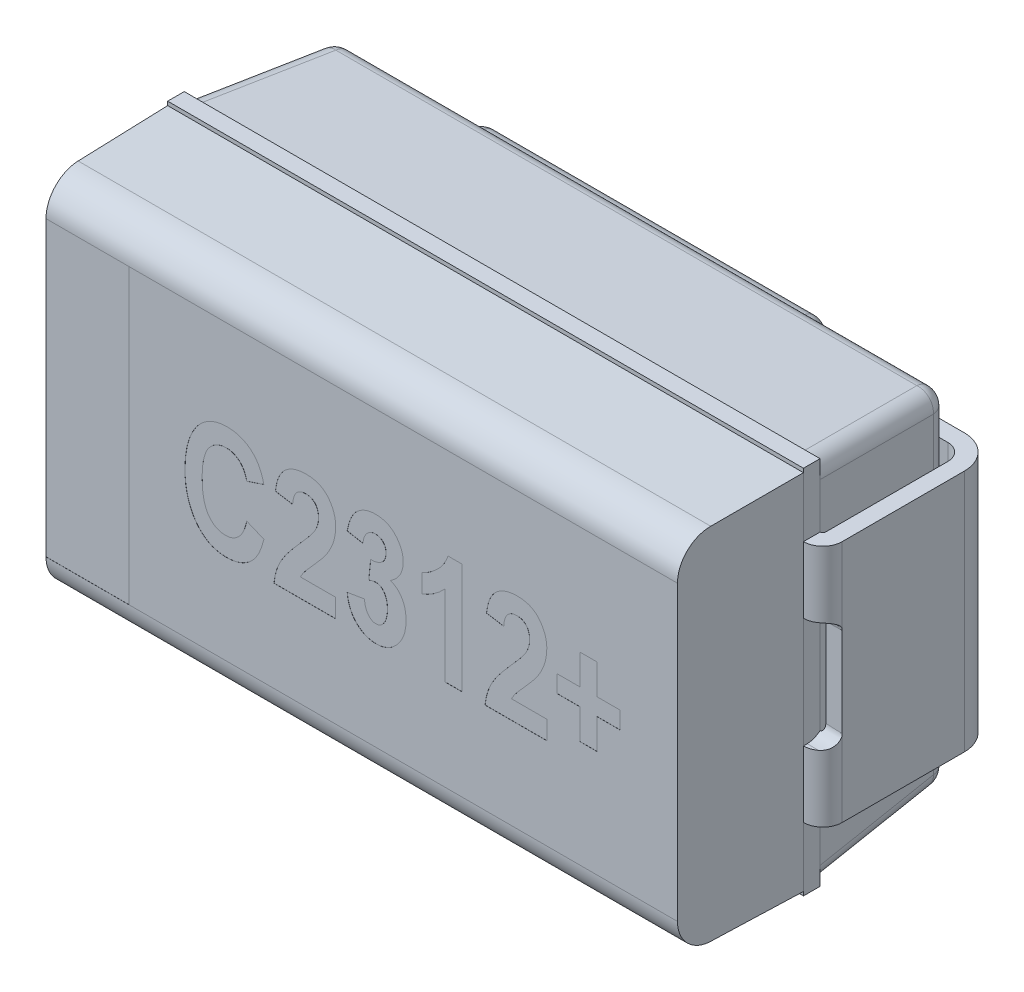
from build123d import *

# Parameters (mm, degrees)
BOSS_EXTRUDE1_START = 1.43
SKETCH1_W           = 5.75
SKETCH1_H           = 3.32
BOSS_EXTRUDE1_DEPTH = 1.26
BOSS_EXTRUDE1_DRAFT = -5
FILLET2_R           = 0.15
SKETCH3_W           = 5.75
SKETCH3_H           = 3.35
BOSS_EXTRUDE2_DEPTH = 0.15
SKETCH4_W           = 5.75
SKETCH4_H           = 3.28
BOSS_EXTRUDE4_DEPTH = 1.12
BOSS_EXTRUDE4_TAPER = 1
FILLET4_R           = 0.30115464
BOSS_EXTRUDE5_START = -0.01
SKETCH5_W           = 3.2
SKETCH5_H           = 2.9
BOSS_EXTRUDE5_DEPTH = 0.16
FILLET5_R           = 0.15
BOSS_EXTRUDE6_DEPTH = 1.1
CUT_EXTRUDE2_DEPTH  = 2.4
SKETCH10_W          = 0.75
SKETCH10_H          = 2.649012974
CUT_EXTRUDE3_DEPTH  = 0.001
CUT_EXTRUDE4_REACH  = 8.723


with BuildPart() as part:
    # Sketch1 → Boss-Extrude1 (with draft: the straight prism first)
    with BuildSketch(Plane.XY.offset(BOSS_EXTRUDE1_START)):
        Rectangle(SKETCH1_W, SKETCH1_H)
    extrude(amount=-BOSS_EXTRUDE1_DEPTH)
    # Boss-Extrude1: the draft: its side faces are tilted about the plane it starts from
    boss_extrude1_sides = [part.faces().sort_by_distance(p)[0] for p in [
        (-2.875, 0, 0.8),
        (0, -1.66, 0.8),
        (2.875, 0, 0.8),
        (0, 1.66, 0.8),
    ]]
    draft(boss_extrude1_sides, Plane.XY.offset(BOSS_EXTRUDE1_START), BOSS_EXTRUDE1_DRAFT)

    # Fillet2
    fillet2_edges = [part.edges().sort_by_distance(p)[0] for p in [
        (0, -1.549764284, 0.17),
        (-2.764764284, 0, 0.17),
        (0, 1.549764284, 0.17),
        (2.764764284, 0, 0.17),
        (-2.819882142, 1.604882142, 0.8),
        (-2.819882142, -1.604882142, 0.8),
        (2.819882142, -1.604882142, 0.8),
        (2.819882142, 1.604882142, 0.8),
    ]]
    fillet(fillet2_edges, radius=FILLET2_R)

    # Sketch3 → Boss-Extrude2 (add)
    with BuildSketch(Plane.XY.offset(1.43)):
        Rectangle(SKETCH3_W, SKETCH3_H)
    extrude(amount=BOSS_EXTRUDE2_DEPTH)

    # Sketch4 → Boss-Extrude4 (add)
    with BuildSketch(Plane.XY.offset(1.58)):
        Rectangle(SKETCH4_W, SKETCH4_H)
    extrude(amount=BOSS_EXTRUDE4_DEPTH, taper=BOSS_EXTRUDE4_TAPER)

    # Fillet4
    fillet4_edges = [part.edges().sort_by_distance(p)[0] for p in [
        (0, -1.620450327, 2.7),
        (0, 1.620450327, 2.7),
    ]]
    fillet(fillet4_edges, radius=FILLET4_R)

    # Sketch5 → Boss-Extrude5 (add)
    with BuildSketch(Plane(origin=(0, 0, 0.17), x_dir=(-1, 0, 0), z_dir=(0, 0, -1)).offset(BOSS_EXTRUDE5_START)):
        Rectangle(SKETCH5_W, SKETCH5_H)
    extrude(amount=BOSS_EXTRUDE5_DEPTH)

    # Fillet5
    fillet5_edges = [part.edges().sort_by_distance(p)[0] for p in [
        (0, -1.45, 0.02),
        (1.6, 0, 0.02),
        (0, 1.45, 0.02),
        (-1.6, 0, 0.02),
        (-1.6, 1.45, 0.097405559),
        (-1.6, -1.45, 0.097405559),
        (1.6, 1.45, 0.097405559),
        (1.6, -1.45, 0.097405559),
    ]]
    fillet(fillet5_edges, radius=FILLET5_R - 0.0001)  # a hair under: the kernel refuses the full size

    # Sketch7 → Boss-Extrude6 (add, symmetric)
    with BuildSketch(Plane(origin=(0, 0, 0), x_dir=(1, 0, 0), z_dir=(0, 1, 0))):
        with BuildLine():
            Line((2.875, -1.58), (2.875, -1.43))
            ThreePointArc((2.875, -1.43), (2.89267767, -1.42267767), (2.9, -1.405))
            Line((2.9, -1.405), (2.9, -0.3))
            ThreePointArc((2.9, -0.3), (2.856066017, -0.193933983), (2.75, -0.15))
            Line((2.75, -0.15), (1.779, -0.15))
            Line((1.779, -0.15), (1.779, 0))
            Line((1.779, 0), (2.75, 0))
            ThreePointArc((2.75, 0), (2.962132034, -0.087867966), (3.05, -0.3))
            Line((3.05, -0.3), (3.05, -1.405))
            ThreePointArc((3.05, -1.405), (2.998743687, -1.528743687), (2.875, -1.58))
        make_face()
        with BuildLine():
            Line((-3.05, -0.3), (-3.05, -1.405))
            ThreePointArc((-3.05, -1.405), (-2.998743687, -1.528743687), (-2.875, -1.58))
            Line((-2.875, -1.58), (-2.875, -1.43))
            ThreePointArc((-2.875, -1.43), (-2.89267767, -1.42267767), (-2.9, -1.405))
            Line((-2.9, -1.405), (-2.9, -0.3))
            ThreePointArc((-2.9, -0.3), (-2.856066017, -0.193933983), (-2.75, -0.15))
            Line((-2.75, -0.15), (-1.779, -0.15))
            Line((-1.779, -0.15), (-1.779, 0))
            Line((-1.779, 0), (-2.75, 0))
            ThreePointArc((-2.75, 0), (-2.962132034, -0.087867966), (-3.05, -0.3))
        make_face()
    extrude(amount=BOSS_EXTRUDE6_DEPTH, both=True)

    # Sketch9 → Cut-Extrude2 (cut)
    with BuildSketch(Plane.ZY.offset(2.875)):
        with BuildLine():
            Line((1.58, 0.686667464), (1.58, -0.686667464))
            add(Edge.make_bspline(
                [(1.58, -0.686667464), (1.573977213, -0.681133658), (1.549992927, -0.675599852), (1.477719503, -0.664532239), (1.429750935, -0.658998432), (1.381568653, -0.653464626)],
                knots=[4.39e-07, 4.39e-07, 4.39e-07, 4.39e-07, 0.5, 0.5, 1, 1, 1, 1], degree=3))
            Line((1.381568653, -0.653464626), (0.844643825, -0.547142878))
            ThreePointArc((0.844643825, -0.547142878), (0.757870339, -0.495208775), (0.723781045, -0.40000001))
            Line((0.723781045, -0.40000001), (0.723781045, 0.39999999))
            ThreePointArc((0.723781045, 0.39999999), (0.757870346, 0.49520876), (0.844643844, 0.547142858))
            Line((0.844643844, 0.547142858), (1.381568671, 0.653464606))
            add(Edge.make_bspline(
                [(1.58, 0.686667464), (1.579173952, 0.685908812), (1.576721603, 0.684291293), (1.570741873, 0.681814465), (1.562141058, 0.679237223), (1.551269301, 0.676659956), (1.538263498, 0.674082696), (1.523287156, 0.671505435), (1.506528622, 0.668928173), (1.488198657, 0.666350913), (1.468527704, 0.663773647), (1.447763395, 0.661196405), (1.426165889, 0.658619072), (1.404010381, 0.656042076), (1.389044845, 0.654323242), (1.381568671, 0.653464606)],
                knots=[0.004712512, 0.004712512, 0.004712512, 0.004712512, 0.008437871, 0.012656806, 0.016875741, 0.021094677, 0.025313612, 0.029532547, 0.033751483, 0.037970418, 0.042189353, 0.046408289, 0.050627224, 0.05484616, 0.059065095, 0.059065095, 0.059065095, 0.059065095], degree=3))
        make_face()
    extrude(amount=CUT_EXTRUDE2_DEPTH, mode=Mode.SUBTRACT)

    # Sketch10 → Cut-Extrude3 (cut)
    with BuildSketch(Plane.XY.offset(2.7)):
        with Locations((-2.480450327, 0)):
            Rectangle(SKETCH10_W, SKETCH10_H)
        with BuildLine():
            Line((-1.040584416, -0.136363636), (-0.88474026, -0.201298701))
            add(Edge.make_bspline(
                [(-0.88474026, -0.201298701), (-0.887958886, -0.214398838), (-0.894230538, -0.239925102), (-0.90609564, -0.276409308), (-0.919151828, -0.310261094), (-0.934088841, -0.34129098), (-0.950394565, -0.3697712), (-0.968506907, -0.395421501), (-0.988085099, -0.418373211), (-1.009240498, -0.438572703), (-1.031938795, -0.455952752), (-1.05554268, -0.47144014), (-1.080661674, -0.4841365), (-1.106944044, -0.494856622), (-1.134596417, -0.502825251), (-1.163408697, -0.508821974), (-1.193504553, -0.512253579), (-1.21400675, -0.512739784), (-1.224431818, -0.512987013)],
                knots=[0, 0, 0, 0, 1.282586353, 2.499182829, 3.646034602, 4.730797578, 5.771318175, 6.763713287, 7.712684321, 8.6363956, 9.539720391, 10.428356747, 11.317388874, 12.212151588, 13.124116906, 14.050177375, 15.008543639, 16, 16, 16, 16], degree=3))
            add(Edge.make_bspline(
                [(-1.224431818, -0.512987013), (-1.237512105, -0.512692936), (-1.263136078, -0.512116846), (-1.300526378, -0.505918262), (-1.336106469, -0.496500592), (-1.369812217, -0.48297676), (-1.401683589, -0.465690424), (-1.431383891, -0.444278756), (-1.459606155, -0.419538879), (-1.476015458, -0.400249065), (-1.484375, -0.390422078)],
                knots=[0, 0, 0, 0, 1.053414494, 2.063614103, 3.046293227, 4.01520277, 4.983805463, 5.961130836, 6.961320097, 8, 8, 8, 8], degree=3))
            add(Edge.make_bspline(
                [(-1.484375, -0.390422078), (-1.493563817, -0.378289428), (-1.512075537, -0.353847085), (-1.535315975, -0.313541703), (-1.555082413, -0.270240344), (-1.571260267, -0.223903762), (-1.583870052, -0.17448062), (-1.592685929, -0.121947356), (-1.597980132, -0.066329381), (-1.598672075, -0.028218004), (-1.599025974, -0.008725649)],
                knots=[0, 0, 0, 0, 0.898140554, 1.809387162, 2.740718204, 3.705966939, 4.703925369, 5.74945803, 6.848943185, 8, 8, 8, 8], degree=3))
            add(Edge.make_bspline(
                [(-1.599025974, -0.008725649), (-1.598702661, 0.011851286), (-1.598072903, 0.051931704), (-1.59240288, 0.110284982), (-1.583759172, 0.165298235), (-1.570871764, 0.216766987), (-1.554727445, 0.264986777), (-1.534781187, 0.309656912), (-1.511621579, 0.351244574), (-1.492725986, 0.376082128), (-1.48336039, 0.388392857)],
                knots=[0, 0, 0, 0, 1.171098873, 2.281104103, 3.334483992, 4.338438261, 5.297974877, 6.225356982, 7.120398547, 8, 8, 8, 8], degree=3))
            add(Edge.make_bspline(
                [(-1.48336039, 0.388392857), (-1.474856891, 0.39834414), (-1.458098318, 0.417955984), (-1.429453931, 0.443351945), (-1.398680865, 0.464939416), (-1.365790257, 0.482614071), (-1.330634933, 0.49636084), (-1.293386951, 0.506060775), (-1.253897178, 0.511784125), (-1.226885866, 0.512579922), (-1.213068182, 0.512987013)],
                knots=[0, 0, 0, 0, 1.017460211, 2.005195831, 2.96880208, 3.936538458, 4.903086366, 5.898753713, 6.925103759, 8, 8, 8, 8], degree=3))
            add(Edge.make_bspline(
                [(-1.213068182, 0.512987013), (-1.201760275, 0.512716343), (-1.179535116, 0.512184355), (-1.146945949, 0.507931398), (-1.115896755, 0.500453169), (-1.08608445, 0.490644065), (-1.057770589, 0.477519585), (-1.030873304, 0.461593795), (-1.005286819, 0.442919053), (-0.989778445, 0.428401184), (-0.981939935, 0.421063312)],
                knots=[0, 0, 0, 0, 1.062174293, 2.087653736, 3.080296642, 4.058948008, 5.03139012, 6.005719887, 6.992016441, 8, 8, 8, 8], degree=3))
            add(Edge.make_bspline(
                [(-0.981939935, 0.421063312), (-0.976489895, 0.415407881), (-0.965384246, 0.403883704), (-0.950430464, 0.384471947), (-0.936585857, 0.363093659), (-0.924098643, 0.339657607), (-0.912489677, 0.314392853), (-0.901933446, 0.28716989), (-0.892646904, 0.257926787), (-0.887416524, 0.237648602), (-0.88474026, 0.227272727)],
                knots=[0, 0, 0, 0, 0.858002413, 1.748367619, 2.673305357, 3.63929672, 4.648357542, 5.711115493, 6.828831091, 8, 8, 8, 8], degree=3))
            Line((-0.88474026, 0.227272727), (-1.040584416, 0.175324675))
            add(Edge.make_bspline(
                [(-1.040584416, 0.175324675), (-1.042048875, 0.181975902), (-1.044898469, 0.194918084), (-1.05061973, 0.213595413), (-1.057585136, 0.230942941), (-1.065163589, 0.247377118), (-1.074289308, 0.262329513), (-1.083835097, 0.276514559), (-1.095028429, 0.28908196), (-1.106853874, 0.300692084), (-1.11972855, 0.310725155), (-1.132906938, 0.319798502), (-1.146781936, 0.327342325), (-1.161295668, 0.333409456), (-1.176276232, 0.338319598), (-1.191835255, 0.341772531), (-1.207937131, 0.34386351), (-1.218878899, 0.34405743), (-1.224431818, 0.344155844)],
                knots=[0, 0, 0, 0, 1.200071046, 2.335138942, 3.437621639, 4.493482591, 5.51985659, 6.521917265, 7.50210956, 8.480124453, 9.438987346, 10.374745328, 11.297656865, 12.216555725, 13.143999084, 14.072438006, 15.021767148, 16, 16, 16, 16], degree=3))
            add(Edge.make_bspline(
                [(-1.224431818, 0.344155844), (-1.232290577, 0.343922841), (-1.24775742, 0.343464266), (-1.270417675, 0.339815754), (-1.291857356, 0.333362554), (-1.312399243, 0.324890773), (-1.331698156, 0.313603838), (-1.349968937, 0.299935201), (-1.366720304, 0.283471785), (-1.382774723, 0.264953268), (-1.397322743, 0.24349724), (-1.409675005, 0.218699776), (-1.419863379, 0.190649404), (-1.428639462, 0.159547299), (-1.435205586, 0.125189117), (-1.439762274, 0.087628064), (-1.442606161, 0.046918611), (-1.44298552, 0.018673715), (-1.443181818, 0.004058442)],
                knots=[0, 0, 0, 0, 0.827686898, 1.628972485, 2.409099021, 3.181967192, 3.964173723, 4.757978677, 5.579415306, 6.433460257, 7.33665582, 8.302235029, 9.343905073, 10.476376866, 11.703364719, 13.024698166, 14.460435141, 16, 16, 16, 16], degree=3))
            add(Edge.make_bspline(
                [(-1.443181818, 0.004058442), (-1.442960011, -0.011095871), (-1.442532877, -0.040278488), (-1.44004303, -0.08242797), (-1.435310422, -0.121153689), (-1.429252325, -0.156607918), (-1.420962386, -0.188583424), (-1.410834625, -0.217099791), (-1.399169055, -0.242435415), (-1.385253281, -0.264257887), (-1.369834328, -0.283097178), (-1.353441161, -0.299453787), (-1.335757292, -0.313117458), (-1.317255811, -0.32469734), (-1.297428776, -0.333472268), (-1.276510752, -0.339442532), (-1.254625793, -0.343571874), (-1.239603138, -0.343958581), (-1.231939935, -0.344155844)],
                knots=[0, 0, 0, 0, 1.588381619, 3.058741945, 4.422565575, 5.675514383, 6.825848758, 7.879737597, 8.8437938, 9.742560847, 10.584031071, 11.391113559, 12.163968987, 12.921455088, 13.673648094, 14.427376256, 15.197789283, 16, 16, 16, 16], degree=3))
            add(Edge.make_bspline(
                [(-1.231939935, -0.344155844), (-1.226319622, -0.34398178), (-1.215170497, -0.343636485), (-1.198764462, -0.341437746), (-1.182932913, -0.337506443), (-1.167673715, -0.332052206), (-1.153051903, -0.324856036), (-1.138917457, -0.316330665), (-1.12555591, -0.306083076), (-1.112620561, -0.294447443), (-1.100420193, -0.281064408), (-1.089269989, -0.265677688), (-1.07891019, -0.248562282), (-1.069403425, -0.229612043), (-1.060689062, -0.208948767), (-1.053005556, -0.18641389), (-1.046052696, -0.162119916), (-1.042442285, -0.14511443), (-1.040584416, -0.136363636)],
                knots=[0, 0, 0, 0, 0.874040642, 1.73385169, 2.568061146, 3.406503852, 4.248567505, 5.09821747, 5.96915136, 6.862782357, 7.800986125, 8.779254107, 9.812897901, 10.908933612, 12.073249979, 13.297367906, 14.609261928, 16, 16, 16, 16], degree=3))
        make_face()
        with BuildLine():
            Line((-0.23538961, -0.331168831), (-0.23538961, -0.5))
            Line((-0.23538961, -0.5), (-0.793831169, -0.5))
            add(Edge.make_bspline(
                [(-0.793831169, -0.5), (-0.791866317, -0.483371878), (-0.787941953, -0.450160812), (-0.77605879, -0.401416985), (-0.760040465, -0.353798597), (-0.742500339, -0.315024186), (-0.725093959, -0.283716795), (-0.709522773, -0.258172511), (-0.690979177, -0.230990775), (-0.669485332, -0.202208417), (-0.645652547, -0.171398924), (-0.61895372, -0.138885435), (-0.589527899, -0.104639318), (-0.56876342, -0.081403726), (-0.558035714, -0.069399351)],
                knots=[0, 0, 0, 0, 1.20268352, 2.402099407, 3.598367202, 4.810420478, 5.454599206, 6.172593709, 6.960183653, 7.818888272, 8.754527026, 9.759992126, 10.842728215, 12, 12, 12, 12], degree=3))
            add(Edge.make_bspline(
                [(-0.558035714, -0.069399351), (-0.549624495, -0.060018232), (-0.533533083, -0.042071313), (-0.510899113, -0.016082491), (-0.490539925, 0.00728779), (-0.47310434, 0.028521986), (-0.457977984, 0.047176105), (-0.445441949, 0.06353451), (-0.435345891, 0.077455394), (-0.429949548, 0.086213896), (-0.427556818, 0.090097403)],
                knots=[0, 0, 0, 0, 1.465870871, 2.804341841, 4.009590698, 5.071600616, 6.000740577, 6.80347298, 7.469461756, 8, 8, 8, 8], degree=3))
            add(Edge.make_bspline(
                [(-0.427556818, 0.090097403), (-0.422003652, 0.100045175), (-0.41116375, 0.119463446), (-0.399875704, 0.150235139), (-0.392497376, 0.181062308), (-0.391651858, 0.201799466), (-0.391233766, 0.212053571)],
                knots=[0, 0, 0, 0, 1.060288104, 2.069705834, 3.04550853, 4, 4, 4, 4], degree=3))
            add(Edge.make_bspline(
                [(-0.391233766, 0.212053571), (-0.391592878, 0.22229899), (-0.3922727, 0.241694223), (-0.398090791, 0.268792662), (-0.407817222, 0.292096946), (-0.421875814, 0.311018077), (-0.438990886, 0.325870439), (-0.458731873, 0.336708568), (-0.481073847, 0.34312894), (-0.496778617, 0.343806663), (-0.50487013, 0.344155844)],
                knots=[0, 0, 0, 0, 1.245810787, 2.358399634, 3.353971925, 4.295778042, 5.200327805, 6.09189762, 7.016895116, 8, 8, 8, 8], degree=3))
            add(Edge.make_bspline(
                [(-0.50487013, 0.344155844), (-0.513644523, 0.343772419), (-0.530462184, 0.343037518), (-0.554115574, 0.336195521), (-0.5746455, 0.324916913), (-0.591469153, 0.308547663), (-0.605276753, 0.288097037), (-0.61524556, 0.262958615), (-0.622080386, 0.233609955), (-0.623987995, 0.212498526), (-0.625, 0.201298701)],
                knots=[0, 0, 0, 0, 0.999920937, 1.916523715, 2.784458762, 3.647604167, 4.570853193, 5.582015381, 6.717234977, 8, 8, 8, 8], degree=3))
            Line((-0.625, 0.201298701), (-0.780844156, 0.227272727))
            add(Edge.make_bspline(
                [(-0.780844156, 0.227272727), (-0.779539175, 0.238664931), (-0.777007666, 0.260764459), (-0.770304359, 0.292507359), (-0.762365711, 0.322012621), (-0.752425553, 0.349127549), (-0.740637748, 0.37388751), (-0.726962358, 0.396265212), (-0.711793679, 0.416637199), (-0.694366186, 0.43431516), (-0.675375297, 0.449781056), (-0.654949188, 0.463317835), (-0.632937475, 0.474637136), (-0.609532151, 0.484076171), (-0.584521383, 0.491064393), (-0.558159607, 0.496414197), (-0.530238043, 0.499431636), (-0.511167658, 0.499807758), (-0.501420455, 0.5)],
                knots=[0, 0, 0, 0, 1.257113927, 2.438652199, 3.554660598, 4.606291011, 5.601856267, 6.557471959, 7.478981492, 8.381416587, 9.2725261, 10.161501808, 11.064119884, 11.98308707, 12.924775989, 13.908409216, 14.930951759, 16, 16, 16, 16], degree=3))
            add(Edge.make_bspline(
                [(-0.501420455, 0.5), (-0.490716075, 0.499827613), (-0.469968042, 0.499493478), (-0.439912108, 0.49515741), (-0.411771104, 0.488979426), (-0.385821922, 0.479369747), (-0.361610884, 0.46781024), (-0.339839404, 0.452845667), (-0.319614456, 0.435885108), (-0.302274267, 0.415749728), (-0.286489574, 0.394466538), (-0.272936617, 0.372035252), (-0.261201946, 0.34905133), (-0.251851055, 0.325103755), (-0.244571208, 0.300378511), (-0.23932489, 0.274928261), (-0.235888474, 0.248741095), (-0.235557623, 0.231003975), (-0.23538961, 0.221996753)],
                knots=[0, 0, 0, 0, 1.185802577, 2.298411505, 3.360827086, 4.373838454, 5.359924385, 6.327149754, 7.295159843, 8.277960573, 9.264958702, 10.230903902, 11.180079425, 12.122922977, 13.076886226, 14.034409875, 15.001838751, 16, 16, 16, 16], degree=3))
            add(Edge.make_bspline(
                [(-0.23538961, 0.221996753), (-0.235560125, 0.211773185), (-0.235898648, 0.1914763), (-0.239375287, 0.161251699), (-0.244510137, 0.131448295), (-0.252127197, 0.102026006), (-0.261976869, 0.072835162), (-0.27397083, 0.043623042), (-0.288182578, 0.014293769), (-0.302177178, -0.010007275), (-0.314716601, -0.030196203), (-0.325882572, -0.04633337), (-0.338607865, -0.063414235), (-0.352535708, -0.081726202), (-0.368212216, -0.100916784), (-0.385255102, -0.121214355), (-0.403723955, -0.142523538), (-0.416645585, -0.156945101), (-0.423295455, -0.164366883)],
                knots=[0, 0, 0, 0, 1.112568374, 2.208785751, 3.308090549, 4.402946702, 5.513734595, 6.659701235, 7.83876403, 9.059051271, 9.71083511, 10.425746939, 11.194567613, 12.029688168, 12.930202216, 13.891926091, 14.915120021, 16, 16, 16, 16], degree=3))
            add(Edge.make_bspline(
                [(-0.423295455, -0.164366883), (-0.429453041, -0.171196406), (-0.441192582, -0.184217004), (-0.457937155, -0.202862367), (-0.472596156, -0.219967087), (-0.485882076, -0.234908665), (-0.497214321, -0.24812573), (-0.506881791, -0.259454044), (-0.514454172, -0.269227136), (-0.52592364, -0.283505668), (-0.539698011, -0.303604164), (-0.549475235, -0.322213644), (-0.554180195, -0.331168831)],
                knots=[0, 0, 0, 0, 1.297038255, 2.472825099, 3.534584971, 4.474279189, 5.292832013, 5.990344774, 6.574432518, 7.036342243, 8.573839243, 10, 10, 10, 10], degree=3))
            Line((-0.554180195, -0.331168831), (-0.23538961, -0.331168831))
        make_face()
        with BuildLine():
            Line((-0.131493506, -0.24025974), (0.024350649, -0.214285714))
            add(Edge.make_bspline(
                [(0.024350649, -0.214285714), (0.025495391, -0.225219963), (0.027666139, -0.245954344), (0.034983579, -0.274766907), (0.045065367, -0.29966597), (0.05820316, -0.320337542), (0.073741895, -0.336515758), (0.090624996, -0.348553548), (0.109211398, -0.355922247), (0.122164023, -0.356735474), (0.128652597, -0.357142857)],
                knots=[0, 0, 0, 0, 1.355304156, 2.570034305, 3.655187229, 4.657770736, 5.572822417, 6.406427783, 7.201705401, 8, 8, 8, 8], degree=3))
            add(Edge.make_bspline(
                [(0.128652597, -0.357142857), (0.135706341, -0.35659551), (0.14978144, -0.355503328), (0.169712312, -0.346537227), (0.187575805, -0.332122407), (0.203295108, -0.312367333), (0.216426, -0.287810082), (0.225607283, -0.25857815), (0.231292989, -0.225329659), (0.231850068, -0.20172985), (0.232142857, -0.189326299)],
                knots=[0, 0, 0, 0, 0.773544105, 1.543536286, 2.359413735, 3.279902328, 4.302047568, 5.405756159, 6.636521274, 8, 8, 8, 8], degree=3))
            add(Edge.make_bspline(
                [(0.232142857, -0.189326299), (0.231856708, -0.177731875), (0.231313924, -0.15573896), (0.2255565, -0.124711405), (0.216358908, -0.097472458), (0.203409949, -0.074453004), (0.187776385, -0.05592036), (0.17016258, -0.042290033), (0.150498797, -0.0339799), (0.136777311, -0.032973925), (0.12987013, -0.032467532)],
                knots=[0, 0, 0, 0, 1.339089583, 2.540055761, 3.633194076, 4.648755064, 5.575000742, 6.418014354, 7.203653244, 8, 8, 8, 8], degree=3))
            add(Edge.make_bspline(
                [(0.12987013, -0.032467532), (0.124985612, -0.032604281), (0.11473325, -0.032891311), (0.098769697, -0.036152524), (0.081352026, -0.040440415), (0.069501819, -0.044667119), (0.063311688, -0.046875)],
                knots=[0, 0, 0, 0, 0.855386015, 1.795412945, 2.848401334, 4, 4, 4, 4], degree=3))
            Line((0.063311688, -0.046875), (0.080357143, 0.123376623))
            add(Edge.make_bspline(
                [(0.080357143, 0.123376623), (0.090534678, 0.123521483), (0.109976789, 0.123798208), (0.137469299, 0.129375617), (0.162051861, 0.138663847), (0.175578733, 0.148687656), (0.182224026, 0.153612013)],
                knots=[0, 0, 0, 0, 1.123342484, 2.145917298, 3.089152036, 4, 4, 4, 4], degree=3))
            add(Edge.make_bspline(
                [(0.182224026, 0.153612013), (0.187963157, 0.159099271), (0.199447313, 0.170079423), (0.210928994, 0.191579846), (0.21811519, 0.215918442), (0.218798596, 0.233236177), (0.219155844, 0.242288961)],
                knots=[0, 0, 0, 0, 0.955076279, 1.911133417, 2.908052488, 4, 4, 4, 4], degree=3))
            add(Edge.make_bspline(
                [(0.219155844, 0.242288961), (0.218886937, 0.24982715), (0.218371304, 0.264281704), (0.213289783, 0.284679232), (0.204595961, 0.302497783), (0.19244077, 0.317368689), (0.177824308, 0.329422325), (0.160966711, 0.338145052), (0.142148969, 0.343347722), (0.128956726, 0.343881039), (0.122159091, 0.344155844)],
                knots=[0, 0, 0, 0, 1.139827297, 2.185630357, 3.156691862, 4.118036265, 5.071436669, 6.005944982, 6.972512938, 8, 8, 8, 8], degree=3))
            add(Edge.make_bspline(
                [(0.122159091, 0.344155844), (0.115279695, 0.343782364), (0.101712228, 0.34304579), (0.082089853, 0.336604107), (0.064021572, 0.3260606), (0.047697443, 0.311432885), (0.033450576, 0.292932751), (0.02259124, 0.270188746), (0.014811201, 0.243598285), (0.01255538, 0.224418398), (0.011363636, 0.214285714)],
                knots=[0, 0, 0, 0, 0.873177957, 1.72207174, 2.597112569, 3.517339763, 4.493004119, 5.547245842, 6.704216451, 8, 8, 8, 8], degree=3))
            Line((0.011363636, 0.214285714), (-0.131493506, 0.24025974))
            add(Edge.make_bspline(
                [(-0.131493506, 0.24025974), (-0.129441418, 0.251240719), (-0.125454333, 0.272576112), (-0.11779878, 0.303245001), (-0.108655695, 0.331586332), (-0.098205359, 0.357632386), (-0.086135275, 0.381256453), (-0.073045607, 0.402729898), (-0.058311953, 0.421749245), (-0.04225434, 0.438493513), (-0.024815018, 0.452897836), (-0.006527709, 0.465671952), (0.013092208, 0.476151285), (0.033622925, 0.484988407), (0.055345342, 0.49165201), (0.078078813, 0.496542579), (0.101997603, 0.499393954), (0.118296022, 0.499795062), (0.126623377, 0.5)],
                knots=[0, 0, 0, 0, 1.323888492, 2.572237035, 3.743577151, 4.851233338, 5.894614541, 6.884670373, 7.827607971, 8.740482364, 9.628407284, 10.504600047, 11.379912067, 12.259984237, 13.150042074, 14.068357082, 15.013065329, 16, 16, 16, 16], degree=3))
            add(Edge.make_bspline(
                [(0.126623377, 0.5), (0.135901887, 0.499774505), (0.154060307, 0.499333203), (0.180521377, 0.495643012), (0.205439391, 0.489490261), (0.229017641, 0.481249528), (0.251048695, 0.470176517), (0.271585866, 0.456663556), (0.290928869, 0.441036631), (0.308062445, 0.422676049), (0.323742015, 0.403278327), (0.337442309, 0.383040895), (0.34906573, 0.362371328), (0.358458733, 0.34108657), (0.365820036, 0.3192863), (0.371038648, 0.29693028), (0.374478606, 0.27411895), (0.374825707, 0.258737998), (0.375, 0.25101461)],
                knots=[0, 0, 0, 0, 1.136110954, 2.223415207, 3.264275915, 4.275773003, 5.276148026, 6.275733691, 7.282435396, 8.313756446, 9.34497766, 10.335353855, 11.303404599, 12.245547817, 13.180854416, 14.117297809, 15.054620354, 16, 16, 16, 16], degree=3))
            add(Edge.make_bspline(
                [(0.375, 0.25101461), (0.374666754, 0.240639653), (0.374012813, 0.220280469), (0.368324228, 0.190539665), (0.359222455, 0.162328526), (0.346277885, 0.135723461), (0.329754647, 0.110754228), (0.30921386, 0.087729266), (0.285568054, 0.065782486), (0.267421033, 0.0532834), (0.258116883, 0.046875)],
                knots=[0, 0, 0, 0, 1.011301464, 1.98451623, 2.942285919, 3.895498898, 4.861777034, 5.853076579, 6.899251942, 8, 8, 8, 8], degree=3))
            add(Edge.make_bspline(
                [(0.258116883, 0.046875), (0.263303633, 0.045235869), (0.273690381, 0.04195342), (0.288398329, 0.034892458), (0.302544555, 0.026823794), (0.315792431, 0.017137347), (0.328417676, 0.006202413), (0.340144672, -0.006242675), (0.351244523, -0.019987029), (0.361439433, -0.035083361), (0.370867118, -0.051359751), (0.37895044, -0.068745748), (0.385574911, -0.087204257), (0.39140201, -0.106457451), (0.395479874, -0.12686889), (0.398843627, -0.148106409), (0.400629802, -0.170423829), (0.400857369, -0.185603301), (0.400974026, -0.19338474)],
                knots=[0, 0, 0, 0, 0.869078506, 1.740376712, 2.603304645, 3.471170013, 4.360750356, 5.271463819, 6.202516728, 7.183826632, 8.182284299, 9.208495033, 10.245655502, 11.31723451, 12.422795936, 13.571969507, 14.755320907, 16, 16, 16, 16], degree=3))
            add(Edge.make_bspline(
                [(0.400974026, -0.19338474), (0.40077702, -0.204694177), (0.400391231, -0.226840894), (0.396282791, -0.259245207), (0.390375735, -0.290255134), (0.381617171, -0.319828899), (0.370184353, -0.347819437), (0.35656353, -0.374474162), (0.340280073, -0.399478935), (0.321610556, -0.422612448), (0.301627042, -0.443860256), (0.280095816, -0.462212388), (0.2578485, -0.477971114), (0.234384095, -0.490686611), (0.210089277, -0.500620406), (0.184790467, -0.507829174), (0.158565961, -0.51218227), (0.140709014, -0.512717086), (0.131696429, -0.512987013)],
                knots=[0, 0, 0, 0, 1.166897813, 2.285079005, 3.366956394, 4.423061867, 5.463022754, 6.484271357, 7.508856759, 8.537242389, 9.549763851, 10.515452122, 11.453061742, 12.359226731, 13.264341812, 14.157335176, 15.069987983, 16, 16, 16, 16], degree=3))
            add(Edge.make_bspline(
                [(0.131696429, -0.512987013), (0.123094682, -0.512742499), (0.106092287, -0.512259187), (0.081147975, -0.508748331), (0.05722287, -0.50306145), (0.034282163, -0.495102189), (0.012374149, -0.484763584), (-0.008477376, -0.471984821), (-0.028404879, -0.457215267), (-0.047053314, -0.440107286), (-0.064310032, -0.42107007), (-0.079754589, -0.400138699), (-0.09317179, -0.377450124), (-0.104746886, -0.353198114), (-0.114553904, -0.327362174), (-0.122143874, -0.299823544), (-0.128201641, -0.270691125), (-0.130378575, -0.250566633), (-0.131493506, -0.24025974)],
                knots=[0, 0, 0, 0, 0.984295986, 1.945580355, 2.876939409, 3.795076914, 4.719719193, 5.643810347, 6.589854471, 7.554313356, 8.535437924, 9.526409237, 10.526171694, 11.547669046, 12.598749286, 13.68449719, 14.814099809, 16, 16, 16, 16], degree=3))
        make_face()
        with BuildLine():
            Line((0.907467532, -0.5), (0.751623377, -0.5))
            Line((0.751623377, -0.5), (0.751623377, 0.227272727))
            add(Edge.make_bspline(
                [(0.751623377, 0.227272727), (0.744064968, 0.219341364), (0.729074875, 0.203611614), (0.70522674, 0.181652296), (0.680553813, 0.161406945), (0.654893287, 0.142783775), (0.628538778, 0.125606026), (0.601156886, 0.110100844), (0.572979793, 0.096235854), (0.553554393, 0.088358519), (0.543831169, 0.084415584)],
                knots=[0, 0, 0, 0, 1.033480345, 2.049633457, 3.05634389, 4.043072978, 5.039658923, 6.022790494, 7.010324124, 8, 8, 8, 8], degree=3))
            Line((0.543831169, 0.084415584), (0.543831169, 0.253246753))
            add(Edge.make_bspline(
                [(0.543831169, 0.253246753), (0.555038642, 0.258227852), (0.578371967, 0.268598217), (0.612507412, 0.289419754), (0.646982835, 0.31549434), (0.675588938, 0.340523891), (0.697900647, 0.362792725), (0.713798532, 0.380332179), (0.728031239, 0.398857957), (0.741221329, 0.417708773), (0.752867315, 0.437423706), (0.763149093, 0.45762428), (0.77227259, 0.478442268), (0.777031571, 0.492788687), (0.779423701, 0.5)],
                knots=[0, 0, 0, 0, 1.256071058, 2.615068939, 4.086222451, 5.682781329, 6.506361962, 7.316438188, 8.106904776, 8.89922375, 9.673254088, 10.451495518, 11.221635059, 12, 12, 12, 12], degree=3))
            Line((0.779423701, 0.5), (0.907467532, 0.5))
            Line((0.907467532, 0.5), (0.907467532, -0.5))
        make_face()
        with BuildLine():
            Line((1.673701299, -0.331168831), (1.673701299, -0.5))
            Line((1.673701299, -0.5), (1.11525974, -0.5))
            add(Edge.make_bspline(
                [(1.11525974, -0.5), (1.117224592, -0.483371878), (1.121148956, -0.450160812), (1.133032119, -0.401416985), (1.149050444, -0.353798597), (1.16659057, -0.315024186), (1.18399695, -0.283716795), (1.199568136, -0.258172511), (1.218111732, -0.230990775), (1.239605577, -0.202208417), (1.263438362, -0.171398924), (1.290137189, -0.138885435), (1.31956301, -0.104639318), (1.340327489, -0.081403726), (1.351055195, -0.069399351)],
                knots=[0, 0, 0, 0, 1.20268352, 2.402099407, 3.598367202, 4.810420478, 5.454599206, 6.172593709, 6.960183653, 7.818888272, 8.754527026, 9.759992126, 10.842728215, 12, 12, 12, 12], degree=3))
            add(Edge.make_bspline(
                [(1.351055195, -0.069399351), (1.359466414, -0.060018232), (1.375557827, -0.042071313), (1.398191796, -0.016082491), (1.418550984, 0.00728779), (1.435986569, 0.028521986), (1.451112926, 0.047176105), (1.46364896, 0.06353451), (1.473745018, 0.077455394), (1.479141361, 0.086213896), (1.481534091, 0.090097403)],
                knots=[0, 0, 0, 0, 1.465870871, 2.804341841, 4.009590698, 5.071600616, 6.000740577, 6.80347298, 7.469461756, 8, 8, 8, 8], degree=3))
            add(Edge.make_bspline(
                [(1.481534091, 0.090097403), (1.487087257, 0.100045175), (1.497927159, 0.119463446), (1.509215205, 0.150235139), (1.516593533, 0.181062308), (1.517439051, 0.201799466), (1.517857143, 0.212053571)],
                knots=[0, 0, 0, 0, 1.060288104, 2.069705834, 3.04550853, 4, 4, 4, 4], degree=3))
            add(Edge.make_bspline(
                [(1.517857143, 0.212053571), (1.517498031, 0.22229899), (1.516818209, 0.241694223), (1.511000118, 0.268792662), (1.501273687, 0.292096946), (1.487215095, 0.311018077), (1.470100023, 0.325870439), (1.450359036, 0.336708568), (1.428017062, 0.34312894), (1.412312292, 0.343806663), (1.404220779, 0.344155844)],
                knots=[0, 0, 0, 0, 1.245810787, 2.358399634, 3.353971925, 4.295778042, 5.200327805, 6.09189762, 7.016895116, 8, 8, 8, 8], degree=3))
            add(Edge.make_bspline(
                [(1.404220779, 0.344155844), (1.395446387, 0.343772419), (1.378628725, 0.343037518), (1.354975336, 0.336195521), (1.33444541, 0.324916913), (1.317621756, 0.308547663), (1.303814156, 0.288097037), (1.293845349, 0.262958615), (1.287010523, 0.233609955), (1.285102915, 0.212498526), (1.284090909, 0.201298701)],
                knots=[0, 0, 0, 0, 0.999920937, 1.916523715, 2.784458762, 3.647604167, 4.570853193, 5.582015381, 6.717234977, 8, 8, 8, 8], degree=3))
            Line((1.284090909, 0.201298701), (1.128246753, 0.227272727))
            add(Edge.make_bspline(
                [(1.128246753, 0.227272727), (1.129551734, 0.238664931), (1.132083244, 0.260764459), (1.13878655, 0.292507359), (1.146725198, 0.322012621), (1.156665356, 0.349127549), (1.168453161, 0.37388751), (1.182128552, 0.396265212), (1.19729723, 0.416637199), (1.214724723, 0.43431516), (1.233715612, 0.449781056), (1.254141721, 0.463317835), (1.276153434, 0.474637136), (1.299558758, 0.484076171), (1.324569526, 0.491064393), (1.350931302, 0.496414197), (1.378852867, 0.499431636), (1.397923251, 0.499807758), (1.407670455, 0.5)],
                knots=[0, 0, 0, 0, 1.257113927, 2.438652199, 3.554660598, 4.606291011, 5.601856267, 6.557471959, 7.478981492, 8.381416587, 9.2725261, 10.161501808, 11.064119884, 11.98308707, 12.924775989, 13.908409216, 14.930951759, 16, 16, 16, 16], degree=3))
            add(Edge.make_bspline(
                [(1.407670455, 0.5), (1.418374834, 0.499827613), (1.439122867, 0.499493478), (1.469178801, 0.49515741), (1.497319805, 0.488979426), (1.523268987, 0.479369747), (1.547480025, 0.46781024), (1.569251505, 0.452845667), (1.589476453, 0.435885108), (1.606816642, 0.415749728), (1.622601335, 0.394466538), (1.636154292, 0.372035252), (1.647888963, 0.34905133), (1.657239854, 0.325103755), (1.664519701, 0.300378511), (1.669766019, 0.274928261), (1.673202435, 0.248741095), (1.673533286, 0.231003975), (1.673701299, 0.221996753)],
                knots=[0, 0, 0, 0, 1.185802577, 2.298411505, 3.360827086, 4.373838454, 5.359924385, 6.327149754, 7.295159843, 8.277960573, 9.264958702, 10.230903902, 11.180079425, 12.122922977, 13.076886226, 14.034409875, 15.001838751, 16, 16, 16, 16], degree=3))
            add(Edge.make_bspline(
                [(1.673701299, 0.221996753), (1.673530784, 0.211773185), (1.673192261, 0.1914763), (1.669715622, 0.161251699), (1.664580773, 0.131448295), (1.656963712, 0.102026006), (1.64711404, 0.072835162), (1.635120079, 0.043623042), (1.620908331, 0.014293769), (1.606913731, -0.010007275), (1.594374308, -0.030196203), (1.583208337, -0.04633337), (1.570483044, -0.063414235), (1.556555201, -0.081726202), (1.540878693, -0.100916784), (1.523835807, -0.121214355), (1.505366954, -0.142523538), (1.492445325, -0.156945101), (1.485795455, -0.164366883)],
                knots=[0, 0, 0, 0, 1.112568374, 2.208785751, 3.308090549, 4.402946702, 5.513734595, 6.659701235, 7.83876403, 9.059051271, 9.71083511, 10.425746939, 11.194567613, 12.029688168, 12.930202216, 13.891926091, 14.915120021, 16, 16, 16, 16], degree=3))
            add(Edge.make_bspline(
                [(1.485795455, -0.164366883), (1.479637868, -0.171196406), (1.467898327, -0.184217004), (1.451153754, -0.202862367), (1.436494753, -0.219967087), (1.423208833, -0.234908665), (1.411876588, -0.24812573), (1.402209118, -0.259454044), (1.394636737, -0.269227136), (1.383167269, -0.283505668), (1.369392898, -0.303604164), (1.359615675, -0.322213644), (1.354910714, -0.331168831)],
                knots=[0, 0, 0, 0, 1.297038255, 2.472825099, 3.534584971, 4.474279189, 5.292832013, 5.990344774, 6.574432518, 7.036342243, 8.573839243, 10, 10, 10, 10], degree=3))
            Line((1.354910714, -0.331168831), (1.673701299, -0.331168831))
        make_face()
        Polygon((1.972402597, -0.357142857), (1.972402597, -0.084415584), (1.76461039, -0.084415584), (1.76461039, 0.071428571), (1.972402597, 0.071428571), (1.972402597, 0.344155844), (2.128246753, 0.344155844), (2.128246753, 0.071428571), (2.336038961, 0.071428571), (2.336038961, -0.084415584), (2.128246753, -0.084415584), (2.128246753, -0.357142857), align=None)
    extrude(amount=-CUT_EXTRUDE3_DEPTH, mode=Mode.SUBTRACT)

    # Sketch12 → Cut-Extrude4 (cut, up to next)
    with BuildSketch(Plane(origin=(2.875, 0, 0), x_dir=(0, 0, -1), z_dir=(1, 0, 0)), mode=Mode.PRIVATE) as cut_extrude4_sk1:
        with BuildLine():
            Line((-1.58, 0.5), (-1.58, -0.5))
            Line((-1.58, -0.5), (-1.54624552, -0.5))
            add(Edge.make_bspline(
                [(-1.402585729, -0.4), (-1.403312899, -0.407342947), (-1.404786552, -0.422223872), (-1.416870661, -0.442770942), (-1.435397504, -0.46070891), (-1.465618995, -0.4799903), (-1.507677168, -0.496930888), (-1.533015165, -0.498947182), (-1.54624552, -0.5)],
                knots=[1.3e-08, 1.3e-08, 1.3e-08, 1.3e-08, 0.100893534, 0.204466825, 0.321180199, 0.458502981, 0.717254772, 1, 1, 1, 1], degree=3))
            Line((-1.402585729, -0.4), (-1.402585729, 0.4))
            add(Edge.make_bspline(
                [(-1.54624552, 0.5), (-1.537481885, 0.499493839), (-1.520561773, 0.498516585), (-1.489013812, 0.48972933), (-1.457134295, 0.475112741), (-1.428402913, 0.455710176), (-1.406609525, 0.429801236), (-1.403891106, 0.409667944), (-1.402585729, 0.4)],
                knots=[0, 0, 0, 0, 0.195151032, 0.376781703, 0.549697207, 0.724505811, 0.867708557, 0.99999998, 0.99999998, 0.99999998, 0.99999998], degree=3))
            Line((-1.54624552, 0.5), (-1.58, 0.5))
        make_face()
    cut_extrude4_tool1 = extrude(cut_extrude4_sk1.sketch, amount=CUT_EXTRUDE4_REACH, mode=Mode.PRIVATE) & part.part
    add(cut_extrude4_tool1.solids().sort_by_distance((2.875, 6e-06, 1.493478))[0], mode=Mode.SUBTRACT)


solid = part.part
